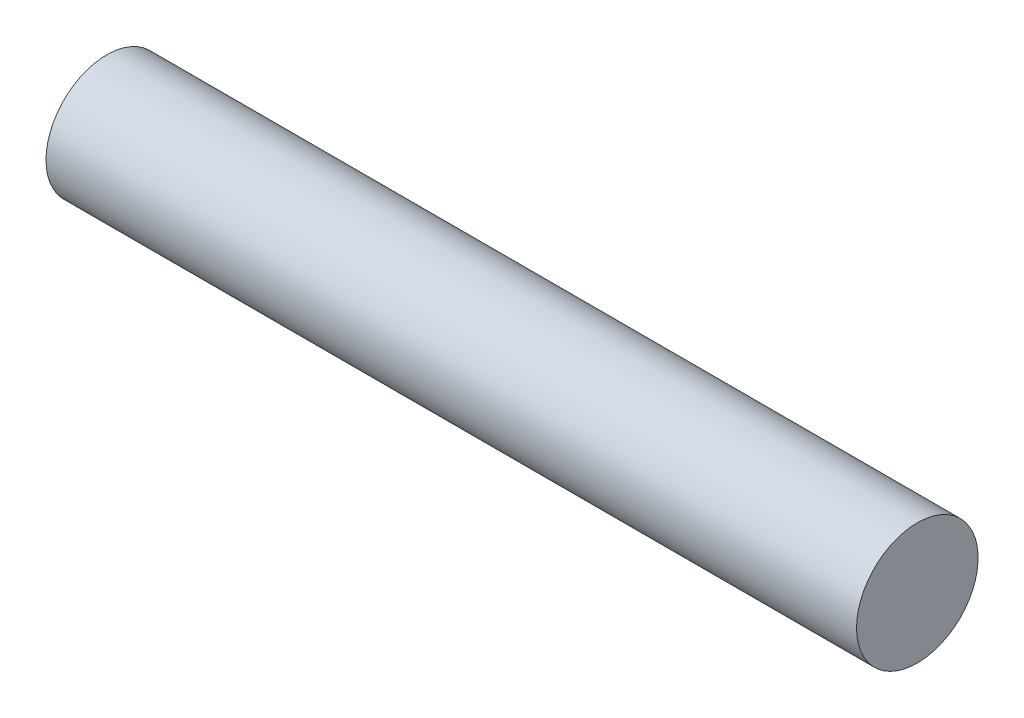
from build123d import *

# Parameters (mm, degrees)
SKETCH1_W = 228.6
SKETCH1_H = 17.145


with BuildPart() as part:
    # Sketch1 → Revolve2 (revolve)
    with BuildSketch(Plane(origin=(0, 0, 0), x_dir=(1, 0, 0), z_dir=(0, 1, 0))):
        with Locations((76.2, -25.7175)):
            Rectangle(SKETCH1_W, SKETCH1_H)
    revolve(axis=Axis((-38.1, 0, 17.145), (1, 0, 0)))


solid = part.part
